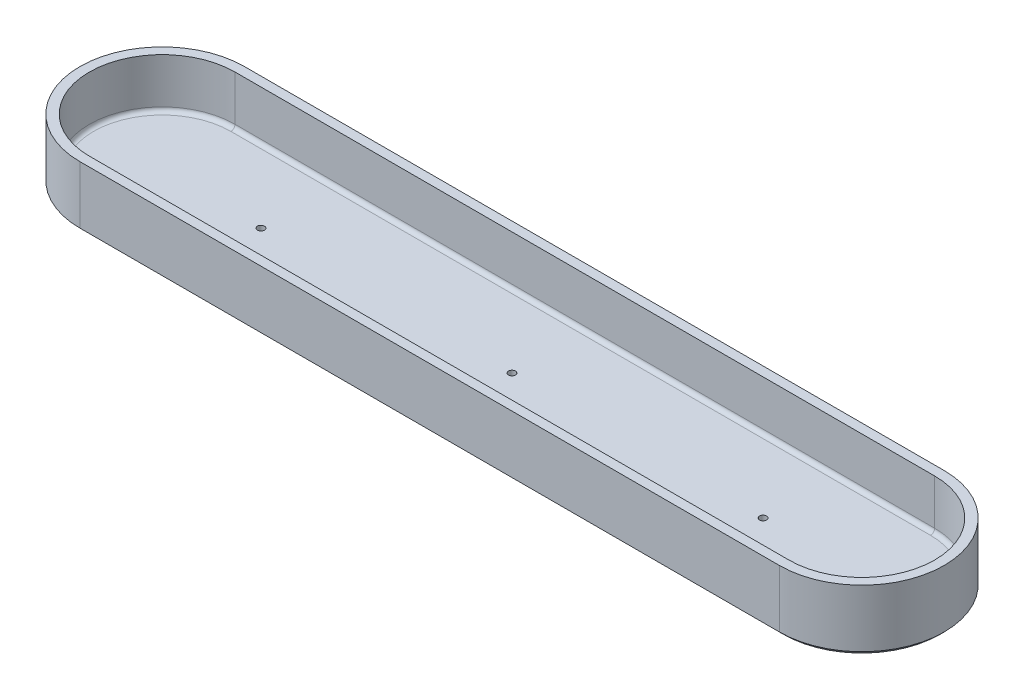
from build123d import *

# Parameters (mm, degrees)
MAINBLOCK_DEPTH     = 3.81
BOSS_EXTRUDE1_DEPTH = 19.05
SKETCH3_R           = 1.0795
CUT_EXTRUDE1_DEPTH  = 138.07766047
FILLET1_R           = 1.27
CHAMFER1_SIZE       = 1.27


with BuildPart() as part:
    # Sketch1 → MainBlock (new body)
    with BuildSketch(Plane(origin=(0, 0, 0), x_dir=(1, 0, 0), z_dir=(0, 1, 0))):
        with BuildLine():
            Line((-107.95, 22.479), (107.95, 22.479))
            ThreePointArc((107.95, 22.479), (130.429, 0), (107.95, -22.479))
            Line((107.95, -22.479), (-107.95, -22.479))
            ThreePointArc((-107.95, -22.479), (-130.429, 0), (-107.95, 22.479))
        make_face()
    extrude(amount=MAINBLOCK_DEPTH)

    # Sketch2 → Boss-Extrude1 (add)
    with BuildSketch(Plane.XZ):
        with BuildLine():
            Line((-107.95, 25.4), (107.95, 25.4))
            ThreePointArc((107.95, 25.4), (133.35, 0), (107.95, -25.4))
            Line((107.95, -25.4), (-107.95, -25.4))
            ThreePointArc((-107.95, -25.4), (-133.35, 0), (-107.95, 25.4))
        make_face()
        with BuildLine():
            Line((107.95, 22.479), (-107.95, 22.479))
            ThreePointArc((-107.95, 22.479), (-130.429, 0), (-107.95, -22.479))
            Line((-107.95, -22.479), (107.95, -22.479))
            ThreePointArc((107.95, -22.479), (130.429, 0), (107.95, 22.479))
        make_face(mode=Mode.SUBTRACT)
    extrude(amount=-BOSS_EXTRUDE1_DEPTH)

    # Sketch3 → Cut-Extrude1 (cut, through all)
    with BuildSketch(Plane.XZ):
        Circle(SKETCH3_R)
        with Locations((-77.47, 0)):
            Circle(SKETCH3_R)
        with Locations((77.47, 0)):
            Circle(SKETCH3_R)
    extrude(amount=-CUT_EXTRUDE1_DEPTH, mode=Mode.SUBTRACT)

    # Fillet1
    fillet1_edges = [part.edges().sort_by_distance(p)[0] for p in [
        (130.429, 3.81, 0),
        (0, 3.81, 22.479),
        (-130.429, 3.81, 0),
        (0, 3.81, -22.479),
    ]]
    fillet(fillet1_edges, radius=FILLET1_R)

    # Chamfer1
    chamfer1_edges = [part.edges().sort_by_distance(p)[0] for p in [
        (0, 0, 25.4),
        (-133.35, 0, 0),
        (133.35, 0, 0),
        (0, 0, -25.4),
    ]]
    chamfer(chamfer1_edges, length=CHAMFER1_SIZE)


solid = part.part
